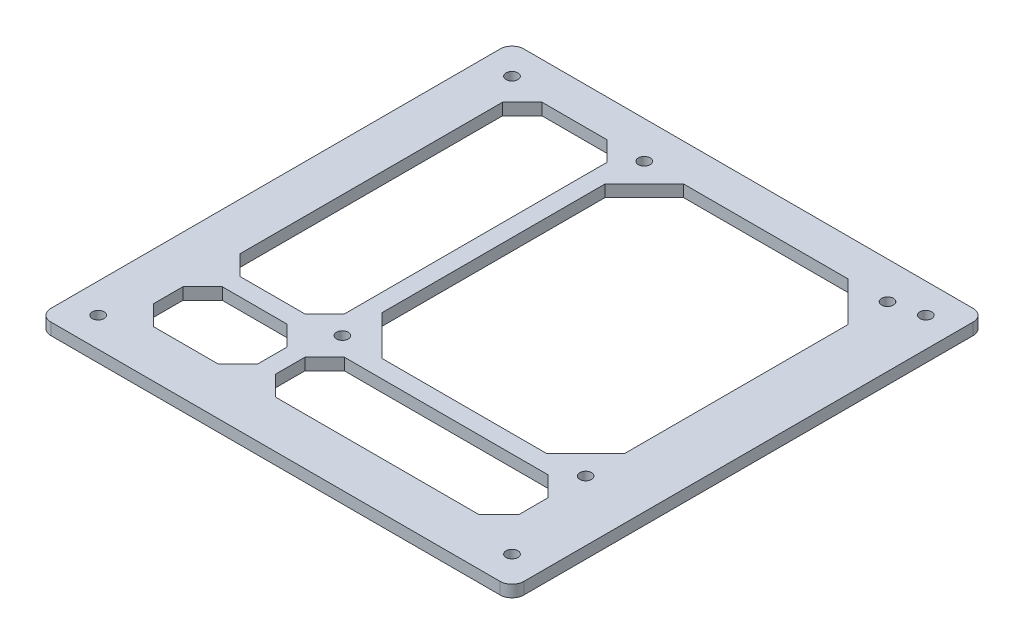
from build123d import *

# Parameters (mm, degrees)
SKETCH_1_W          = 120
SKETCH_1_H          = 120
SKETCH_1_R          = 1.5
EXTRUDE_1_DEPTH     = 3
F_3_0MM_1_D         = 3
CUT_EXTRUDE_1_DEPTH = 85.905830189
SKETCH_6_W          = 26.465
SKETCH_6_H          = 76.6
SKETCH_6_W_2        = 61.72
SKETCH_6_H_2        = 17.5
CUT_EXTRUDE_2_DEPTH = 85.905830189
CHAMFER_1_SIZE      = 5
FILLET_1_R          = 3


with BuildPart() as part:
    # 草圖1 → 填料-伸長1 (new body)
    with BuildSketch(Plane(origin=(0, 0, 0), x_dir=(1, 0, 0), z_dir=(0, 1, 0))):
        Rectangle(SKETCH_1_W, SKETCH_1_H)
        with Locations((-52.5, 52.5)):
            Circle(SKETCH_1_R, mode=Mode.SUBTRACT)
        with Locations((52.5, 52.5)):
            Circle(SKETCH_1_R, mode=Mode.SUBTRACT)
        with Locations((52.5, -52.5)):
            Circle(SKETCH_1_R, mode=Mode.SUBTRACT)
        with Locations((-52.5, -52.5)):
            Circle(SKETCH_1_R, mode=Mode.SUBTRACT)
    extrude(amount=EXTRUDE_1_DEPTH)

    # Ø3.0mm 定位孔1 (through all)
    with Locations(Plane(origin=(-17.035, 3, -50.6), x_dir=(0, 0, 1), z_dir=(0, 1, 0))):
        with Locations((0, 0), (0, 61.72), (76.6, 61.72), (76.6, 0)):
            Hole(F_3_0MM_1_D / 2)

    # 草圖4 → 除料-伸長1 (cut, through all)
    with BuildSketch(Plane(origin=(0, 3, 0), x_dir=(1, 0, 0), z_dir=(0, 1, 0))):
        Polygon((-17.035, 40.6), (-7.035, 50.6), (34.685, 50.6), (44.685, 40.6), (44.685, -16), (34.685, -26), (-7.035, -26), (-17.035, -16), align=None)
    extrude(amount=-CUT_EXTRUDE_1_DEPTH, mode=Mode.SUBTRACT)

    # 草圖6 → 除料-伸長2 (cut, through all)
    with BuildSketch(Plane(origin=(0, 3, 0), x_dir=(1, 0, 0), z_dir=(0, 1, 0))):
        with Locations((-34.7675, 12.3)):
            Rectangle(SKETCH_6_W, SKETCH_6_H)
        with Locations((13.825, -39.25)):
            Rectangle(SKETCH_6_W_2, SKETCH_6_H_2)
        with Locations((-34.7675, -39.25)):
            Rectangle(SKETCH_6_W, SKETCH_6_H_2)
    extrude(amount=-CUT_EXTRUDE_2_DEPTH, mode=Mode.SUBTRACT)

    # 導角1
    chamfer_1_edges = [part.edges().sort_by_distance(p)[0] for p in [
        (-17.035, 1.5, 48),
        (44.685, 1.5, 48),
        (44.685, 1.5, 30.5),
        (-17.035, 1.5, 30.5),
        (-21.535, 1.5, 48),
        (-48, 1.5, 48),
        (-48, 1.5, 30.5),
        (-21.535, 1.5, 30.5),
        (-48, 1.5, 26),
        (-21.535, 1.5, 26),
        (-48, 1.5, -50.6),
        (-21.535, 1.5, -50.6),
    ]]
    chamfer(chamfer_1_edges, length=CHAMFER_1_SIZE)

    # 圓角1
    fillet_1_edges = [part.edges().sort_by_distance(p)[0] for p in [
        (-60, 1.5, 60),
        (60, 1.5, 60),
        (60, 1.5, -60),
        (-60, 1.5, -60),
    ]]
    fillet(fillet_1_edges, radius=FILLET_1_R)


solid = part.part
